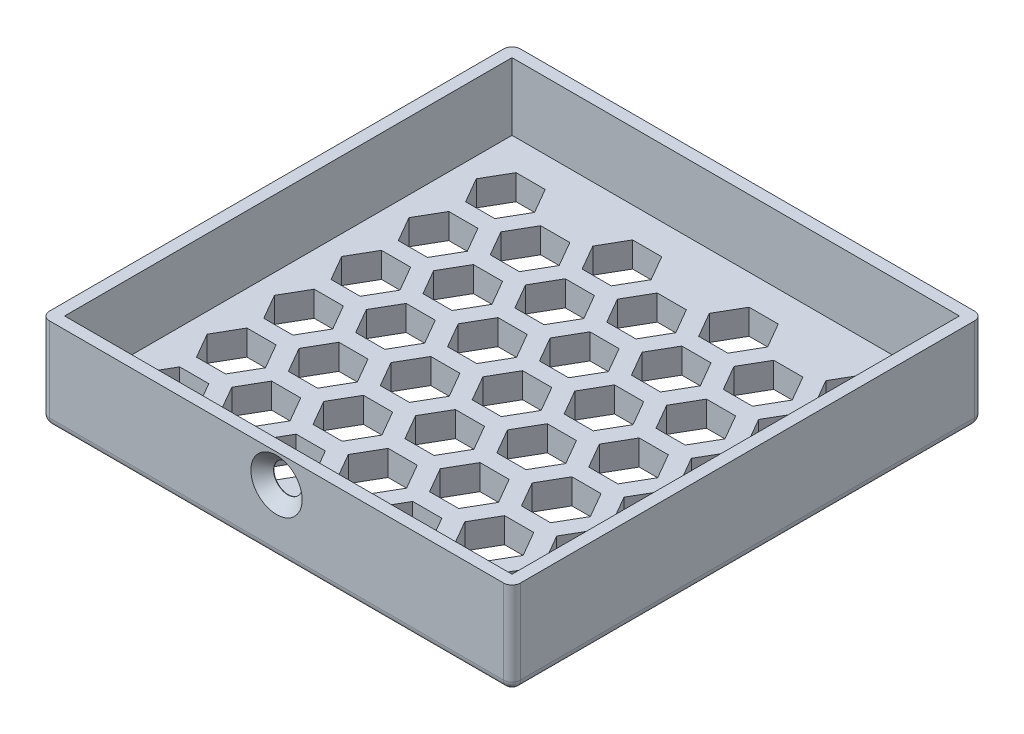
from build123d import *

# Parameters (mm, degrees)
SKETCH1_W           = 56
SKETCH1_H           = 56
BOSS_EXTRUDE1_DEPTH = 11
SKETCH2_W           = 53.2
SKETCH2_H           = 53.2
CUT_EXTRUDE1_DEPTH  = 8
SKETCH3_R           = 1.7
CUT_EXTRUDE2_DEPTH  = 1.4
FILLET1_R           = 1
CHAMFER1_SIZE       = 1.35
FILL_PATTERN1_DEPTH = 3


# Read off the part's stored shape, not the designer's step: Fill Pattern1
with BuildPart() as part:
    # Sketch1 → Boss-Extrude1 (new body)
    with BuildSketch(Plane(origin=(0, 0, 0), x_dir=(1, 0, 0), z_dir=(0, 1, 0))):
        Rectangle(SKETCH1_W, SKETCH1_H)
    extrude(amount=BOSS_EXTRUDE1_DEPTH)

    # Sketch2 → Cut-Extrude1 (cut)
    with BuildSketch(Plane(origin=(0, 11, 0), x_dir=(1, 0, 0), z_dir=(0, 1, 0))):
        Rectangle(SKETCH2_W, SKETCH2_H)
    extrude(amount=-CUT_EXTRUDE1_DEPTH, mode=Mode.SUBTRACT)

    # Sketch3 → Cut-Extrude2 (cut)
    with BuildSketch(Plane.XY.offset(28)):
        with Locations((0, 7.6)):
            Circle(SKETCH3_R)
    extrude(amount=-CUT_EXTRUDE2_DEPTH, mode=Mode.SUBTRACT)

    # Fillet1
    fillet1_edges = [part.edges().sort_by_distance(p)[0] for p in [
        (0, 0, 28),
        (-28, 0, 0),
        (0, 0, -28),
        (28, 0, 0),
        (28, 5.5, 28),
        (-28, 5.5, 28),
        (-28, 5.5, -28),
        (28, 5.5, -28),
    ]]
    fillet(fillet1_edges, radius=FILLET1_R)

    # Chamfer1
    chamfer1_edges = [part.edges().sort_by_distance(p)[0] for p in [
        (-1.7, 7.6, 28),
    ]]
    chamfer(chamfer1_edges, length=CHAMFER1_SIZE)

    # Fill Pattern1 outline → Fill Pattern1 (cut)
    with BuildSketch(Plane(origin=(0, 0, 0), x_dir=(1, 0, 0), z_dir=(0, 1, 0))):
        Polygon((22.516660498, 17), (24.248711306, 20), (22.516660498, 23), (19.052558883, 23), (17.320508076, 20), (19.052558883, 17), align=None)
        Polygon((1.732050808, -19), (3.464101615, -16), (1.732050808, -13), (-1.732050808, -13), (-3.464101615, -16), (-1.732050808, -19), align=None)
        Polygon((8.660254038, -7), (10.392304845, -4), (8.660254038, -1), (5.196152423, -1), (3.464101615, -4), (5.196152423, -7), align=None)
        Polygon((15.588457268, 5), (17.320508076, 8), (15.588457268, 11), (12.124355653, 11), (10.392304845, 8), (12.124355653, 5), align=None)
        Polygon((-19.052558883, 23), (-22.516660498, 23), (-24.248711306, 20), (-22.516660498, 17), (-19.052558883, 17), (-17.320508076, 20), align=None)
        Polygon((-5.196152423, 23), (-8.660254038, 23), (-10.392304845, 20), (-8.660254038, 17), (-5.196152423, 17), (-3.464101615, 20), align=None)
        Polygon((8.660254038, 23), (5.196152423, 23), (3.464101615, 20), (5.196152423, 17), (8.660254038, 17), (10.392304845, 20), align=None)
        Polygon((22.516660498, -7), (24.248711306, -4), (22.516660498, -1), (19.052558883, -1), (17.320508076, -4), (19.052558883, -7), align=None)
        Polygon((15.588457268, -19), (17.320508076, -16), (15.588457268, -13), (12.124355653, -13), (10.392304845, -16), (12.124355653, -19), align=None)
        Polygon((-19.052558883, -1), (-22.516660498, -1), (-24.248711306, -4), (-22.516660498, -7), (-19.052558883, -7), (-17.320508076, -4), align=None)
        Polygon((-5.196152423, -1), (-8.660254038, -1), (-10.392304845, -4), (-8.660254038, -7), (-5.196152423, -7), (-3.464101615, -4), align=None)
        Polygon((3.464101615, 8), (1.732050808, 11), (-1.732050808, 11), (-3.464101615, 8), (-1.732050808, 5), (1.732050808, 5), align=None)
        Polygon((-12.124355653, -13), (-15.588457268, -13), (-17.320508076, -16), (-15.588457268, -19), (-12.124355653, -19), (-10.392304845, -16), align=None)
        Polygon((15.588457268, -11), (17.320508076, -8), (15.588457268, -5), (12.124355653, -5), (10.392304845, -8), (12.124355653, -11), align=None)
        Polygon((22.516660498, 1), (24.248711306, 4), (22.516660498, 7), (19.052558883, 7), (17.320508076, 4), (19.052558883, 1), align=None)
        Polygon((8.660254038, -23), (10.392304845, -20), (8.660254038, -17), (5.196152423, -17), (3.464101615, -20), (5.196152423, -23), align=None)
        Polygon((24.248711306, -20), (22.516660498, -17), (19.052558883, -17), (17.320508076, -20), (19.052558883, -23), (22.516660498, -23), align=None)
        Polygon((3.464101615, 16), (1.732050808, 19), (-1.732050808, 19), (-3.464101615, 16), (-1.732050808, 13), (1.732050808, 13), align=None)
        Polygon((10.392304845, 4), (8.660254038, 7), (5.196152423, 7), (3.464101615, 4), (5.196152423, 1), (8.660254038, 1), align=None)
        Polygon((-12.124355653, -5), (-15.588457268, -5), (-17.320508076, -8), (-15.588457268, -11), (-12.124355653, -11), (-10.392304845, -8), align=None)
        Polygon((1.732050808, -5), (-1.732050808, -5), (-3.464101615, -8), (-1.732050808, -11), (1.732050808, -11), (3.464101615, -8), align=None)
        Polygon((15.588457268, -3), (17.320508076, 0), (15.588457268, 3), (12.124355653, 3), (10.392304845, 0), (12.124355653, -3), align=None)
        Polygon((22.516660498, 9), (24.248711306, 12), (22.516660498, 15), (19.052558883, 15), (17.320508076, 12), (19.052558883, 9), align=None)
        Polygon((8.660254038, -15), (10.392304845, -12), (8.660254038, -9), (5.196152423, -9), (3.464101615, -12), (5.196152423, -15), align=None)
        Polygon((24.248711306, -12), (22.516660498, -9), (19.052558883, -9), (17.320508076, -12), (19.052558883, -15), (22.516660498, -15), align=None)
        Polygon((10.392304845, 12), (8.660254038, 15), (5.196152423, 15), (3.464101615, 12), (5.196152423, 9), (8.660254038, 9), align=None)
        Polygon((-12.124355653, 3), (-15.588457268, 3), (-17.320508076, 0), (-15.588457268, -3), (-12.124355653, -3), (-10.392304845, 0), align=None)
        Polygon((1.732050808, 3), (-1.732050808, 3), (-3.464101615, 0), (-1.732050808, -3), (1.732050808, -3), (3.464101615, 0), align=None)
        Polygon((-19.052558883, -9), (-22.516660498, -9), (-24.248711306, -12), (-22.516660498, -15), (-19.052558883, -15), (-17.320508076, -12), align=None)
        Polygon((-5.196152423, -9), (-8.660254038, -9), (-10.392304845, -12), (-8.660254038, -15), (-5.196152423, -15), (-3.464101615, -12), align=None)
        Polygon((-19.052558883, -17), (-22.516660498, -17), (-24.248711306, -20), (-22.516660498, -23), (-19.052558883, -23), (-17.320508076, -20), align=None)
        Polygon((-5.196152423, -17), (-8.660254038, -17), (-10.392304845, -20), (-8.660254038, -23), (-5.196152423, -23), (-3.464101615, -20), align=None)
        Polygon((15.588457268, 13), (17.320508076, 16), (15.588457268, 19), (12.124355653, 19), (10.392304845, 16), (12.124355653, 13), align=None)
        Polygon((-12.124355653, 19), (-15.588457268, 19), (-17.320508076, 16), (-15.588457268, 13), (-12.124355653, 13), (-10.392304845, 16), align=None)
        Polygon((-5.196152423, 1), (-3.464101615, 4), (-5.196152423, 7), (-8.660254038, 7), (-10.392304845, 4), (-8.660254038, 1), align=None)
        Polygon((-19.052558883, 1), (-17.320508076, 4), (-19.052558883, 7), (-22.516660498, 7), (-24.248711306, 4), (-22.516660498, 1), align=None)
        Polygon((-12.124355653, 5), (-10.392304845, 8), (-12.124355653, 11), (-15.588457268, 11), (-17.320508076, 8), (-15.588457268, 5), align=None)
        Polygon((-19.052558883, 15), (-22.516660498, 15), (-24.248711306, 12), (-22.516660498, 9), (-19.052558883, 9), (-17.320508076, 12), align=None)
        Polygon((-5.196152423, 15), (-8.660254038, 15), (-10.392304845, 12), (-8.660254038, 9), (-5.196152423, 9), (-3.464101615, 12), align=None)
    extrude(amount=FILL_PATTERN1_DEPTH, mode=Mode.SUBTRACT)


solid = part.part
